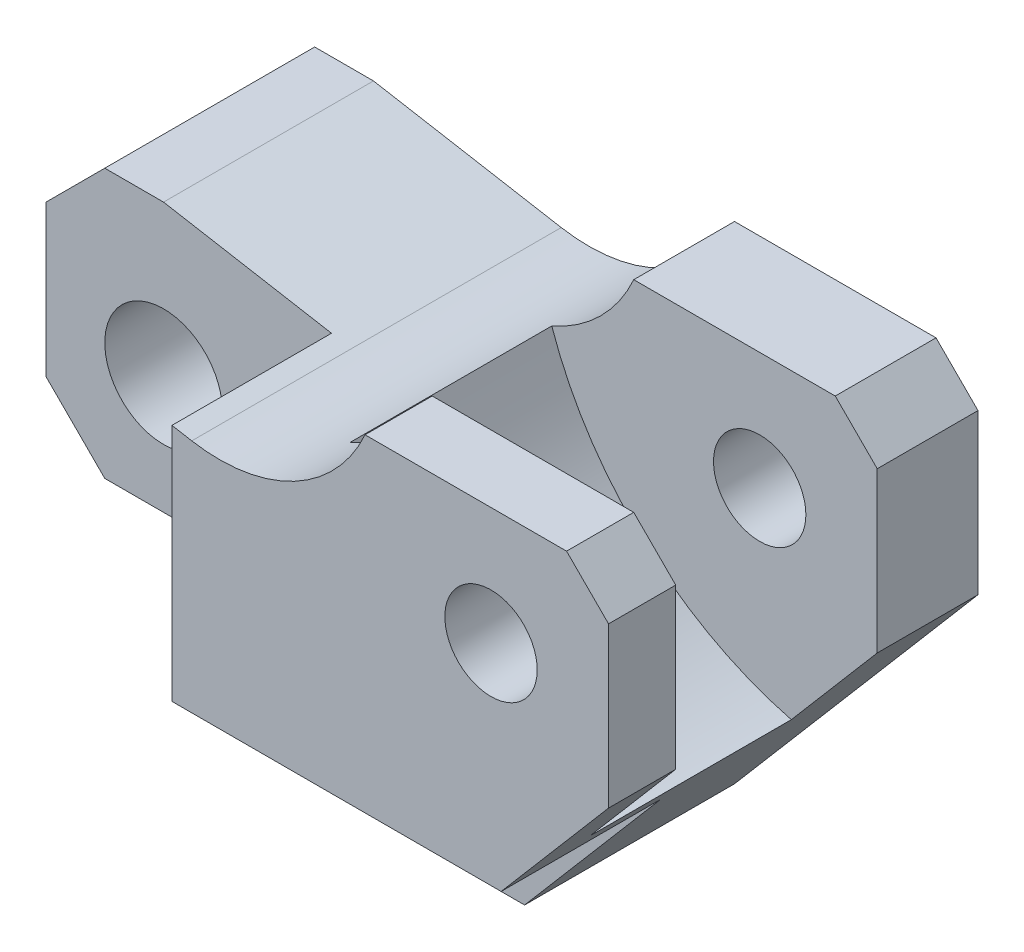
from build123d import *

# Parameters (mm, degrees)
ESQUISSE1_R              = 7
BOSS_EXTRU_2_DEPTH       = 44
ENL_V_START              = -19
ESQUISSE2_R              = 7
ENL_V_MAT_EXTRU_1_DEPTH  = 19
ENL_V_MAT_EXTRU_2_DEPTH  = 19
ESQUISSE3_R              = 5.5
ENL_V_MAT_EXTRU_3_DEPTH  = 103.815841668
ENL_V_MAT_EXTRU_21_DEPTH = 24


with BuildPart() as part:
    # Esquisse1 → Boss.-Extru.2 (new body)
    with BuildSketch(Plane.XY):
        with BuildLine():
            Line((40.010307264, -4.230818644), (64.010307264, -4.230818644))
            Line((64.010307264, -4.230818644), (69.010307264, -9.230818644))
            Line((69.010307264, -9.230818644), (69.010307264, -28.230818644))
            Line((69.010307264, -28.230818644), (40.010307264, -62.230818644))
            Line((40.010307264, -62.230818644), (34.307287317, -62.230818644))
            ThreePointArc((34.307287317, -62.230818644), (29.86831512, -55.346490705), (27.531484917, -47.495524527))
            ThreePointArc((27.531484917, -47.495524527), (25.851081957, -44.444232412), (22.585846175, -43.230818644))
            Line((22.585846175, -43.230818644), (-9.989692736, -43.230818644))
            Line((-9.989692736, -43.230818644), (-16.989692736, -36.230818644))
            Line((-16.989692736, -36.230818644), (-16.989692736, -18.230818644))
            Line((-16.989692736, -18.230818644), (-9.989692736, -11.230818644))
            Line((-9.989692736, -11.230818644), (-2.989692736, -11.230818644))
            Line((-2.989692736, -11.230818644), (19.3716881, -15.173733412))
            ThreePointArc((19.3716881, -15.173733412), (31.57140597, -13.248774502), (40.010307264, -4.230818644))
        make_face()
        with Locations((-2.989692736, -29.230818644)):
            Circle(ESQUISSE1_R, mode=Mode.SUBTRACT)
    extrude(amount=BOSS_EXTRU_2_DEPTH)

    # Esquisse2 → Enlèv. mat.-Extru.1 (cut)
    with BuildSketch(Plane.XY.offset(44).offset(ENL_V_START)):
        Polygon((-9.989692736, -43.230818644), (17.010307264, -43.230818644), (17.010307264, -14.757358259), (-2.989692736, -11.230818644), (-9.989692736, -11.230818644), (-16.989692736, -18.230818644), (-16.989692736, -36.230818644), align=None)
        with Locations((-2.989692736, -29.230818644)):
            Circle(ESQUISSE2_R, mode=Mode.SUBTRACT)
    extrude(amount=ENL_V_MAT_EXTRU_1_DEPTH, mode=Mode.SUBTRACT)

    # Esquisse2<4> → Enlèv. mat.-Extru.2 (cut)
    with BuildSketch(Plane.XY.offset(44).offset(ENL_V_START)):
        with BuildLine():
            Line((40.010307264, -62.230818644), (56.216189617, -43.230818644))
            Line((56.216189617, -43.230818644), (22.585846175, -43.230818644))
            ThreePointArc((22.585846175, -43.230818644), (25.851081957, -44.444232412), (27.531484917, -47.495524527))
            ThreePointArc((27.531484917, -47.495524527), (29.86831512, -55.346490705), (34.307287317, -62.230818644))
            Line((34.307287317, -62.230818644), (40.010307264, -62.230818644))
        make_face()
    extrude(amount=ENL_V_MAT_EXTRU_2_DEPTH, mode=Mode.SUBTRACT)

    # Esquisse3 → Enlèv. mat.-Extru.3 (cut, through all)
    with BuildSketch(Plane.XY.offset(44)):
        with Locations((55.010307264, -18.230818644)):
            Circle(ESQUISSE3_R)
    extrude(amount=-ENL_V_MAT_EXTRU_3_DEPTH, mode=Mode.SUBTRACT)

    # Esquisse8 → Enlèv. mat.-Extru.21 (cut)
    with BuildSketch(Plane(origin=(0, 0, 12), x_dir=(-1, 0, 0), z_dir=(0, 0, -1))):
        with BuildLine():
            ThreePointArc((-30.247243813, -13.886524027), (-36.031551607, -9.971485024), (-40.010307264, -4.230818644))
            Line((-40.010307264, -4.230818644), (-64.010307264, -4.230818644))
            Line((-64.010307264, -4.230818644), (-69.010307264, -9.230818644))
            Line((-69.010307264, -9.230818644), (-69.010307264, -28.230818644))
            Line((-69.010307264, -28.230818644), (-58.775013146, -40.230818644))
            ThreePointArc((-58.775013146, -40.230818644), (-41.194570247, -30.650113416), (-30.247243813, -13.886524027))
        make_face()
    extrude(amount=-ENL_V_MAT_EXTRU_21_DEPTH, mode=Mode.SUBTRACT)


solid = part.part
